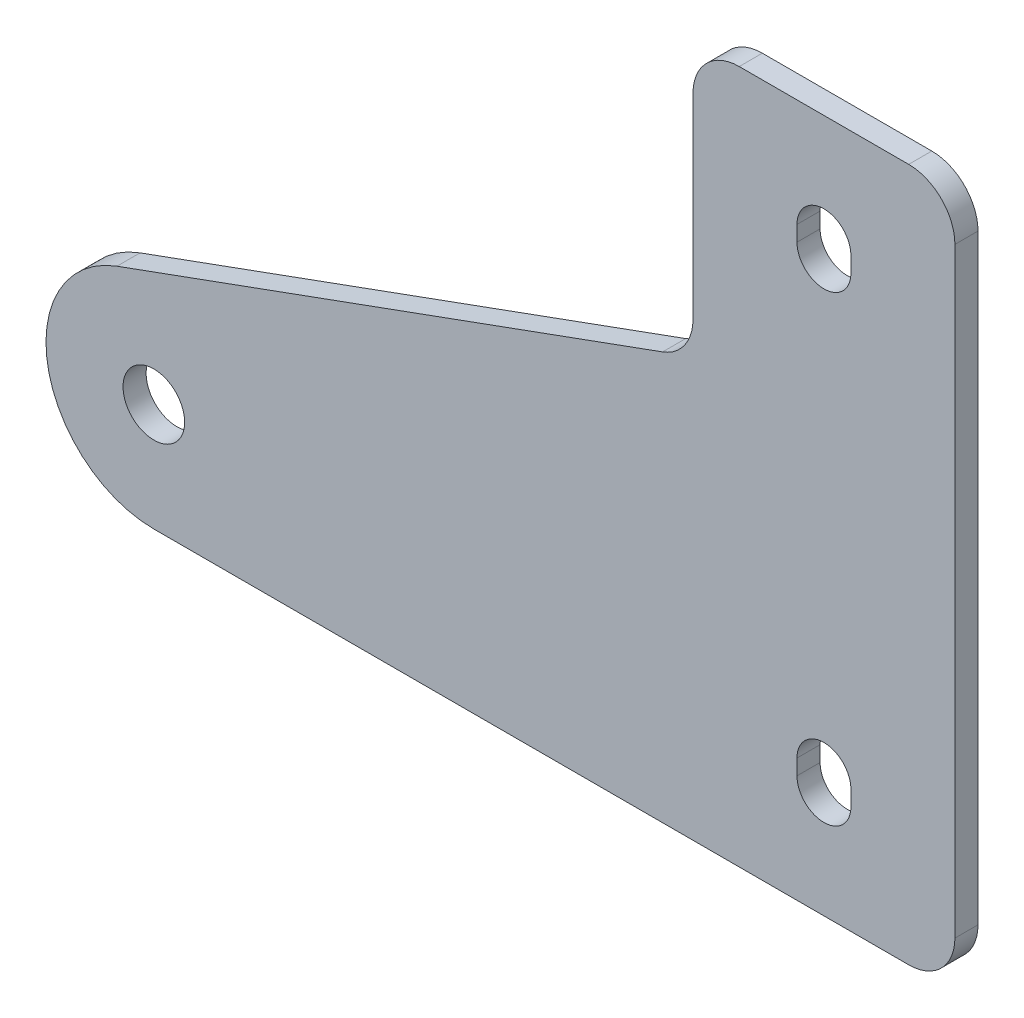
from build123d import *

# Parameters (mm, degrees)
ESQUISSE1_R               = 2
T_LE_DE_BASE_PLI_E1_DEPTH = 1.5
CONG_1_R                  = 3


# Sheet-metal steps are written as plain solids
with BuildPart() as part:
    # Esquisse1 → Tôle de base pliée1 (new body)
    with BuildSketch(Plane.XY):
        with BuildLine():
            Line((-8.5, 37.5), (8.5, 37.5))
            Line((8.5, 37.5), (8.5, -7.5))
            Line((8.5, -7.5), (-43.5, -7.5))
            ThreePointArc((-43.5, -7.5), (-50.393654271, -1.715537244), (-45.894141003, 6.077848346))
            Line((-45.894141003, 6.077848346), (-8.5, 19.688202607))
            Line((-8.5, 19.688202607), (-8.5, 37.5))
        make_face()
        with Locations((-43.5, -0.5)):
            Circle(ESQUISSE1_R, mode=Mode.SUBTRACT)
        with BuildLine():
            Line((1.75, 0.5), (1.75, -0.5))
            ThreePointArc((1.75, -0.5), (0, -2.25), (-1.75, -0.5))
            Line((-1.75, -0.5), (-1.75, 0.5))
            ThreePointArc((-1.75, 0.5), (0, 2.25), (1.75, 0.5))
        make_face(mode=Mode.SUBTRACT)
        with BuildLine():
            Line((1.75, 30.5), (1.75, 29.5))
            ThreePointArc((1.75, 29.5), (0, 27.75), (-1.75, 29.5))
            Line((-1.75, 29.5), (-1.75, 30.5))
            ThreePointArc((-1.75, 30.5), (0, 32.25), (1.75, 30.5))
        make_face(mode=Mode.SUBTRACT)
    extrude(amount=-T_LE_DE_BASE_PLI_E1_DEPTH)

    # Congé1
    cong_1_edges = [part.edges().sort_by_distance(p)[0] for p in [
        (-8.5, 37.5, -0.75),
        (8.5, 37.5, -0.75),
        (8.5, -7.5, -0.75),
        (-8.5, 19.688202607, -0.75),
    ]]
    fillet(cong_1_edges, radius=CONG_1_R)


solid = part.part
